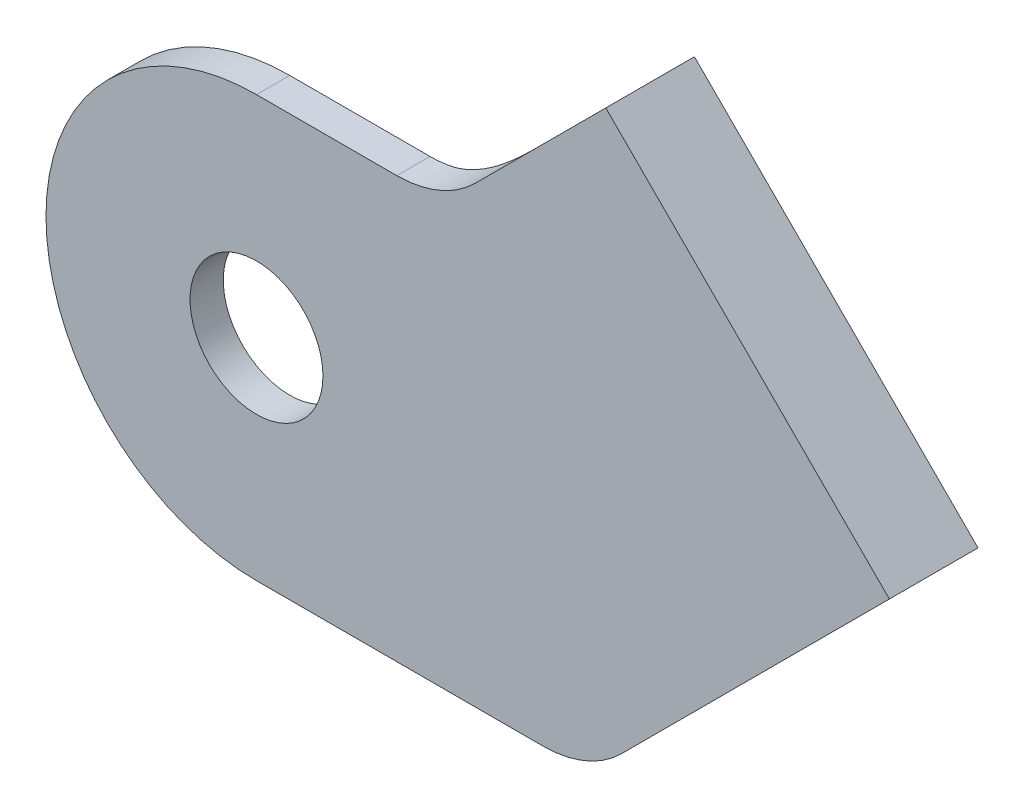
from build123d import *

# Parameters (mm, degrees)
SKETCH1_R           = 2.5
BOSS_EXTRUDE1_DEPTH = 3
SKETCH2_R           = 1.5
CUT_EXTRUDE1_DEPTH  = 77.127156728
FILLET1_R           = 10
SKETCH3_R           = 6
CUT_EXTRUDE2_DEPTH  = 77.127156728
BOSS_EXTRUDE3_DEPTH = 5
FILLET3_START       = -3.356502253
FILLET3_DEPTH       = 38.004734531
FILLET3_START_2     = -6
FILLET3_2_DEPTH     = 6


with BuildPart() as part:
    # Sketch1 → Boss-Extrude1 (new body)
    with BuildSketch(Plane.XY):
        with BuildLine():
            Line((0, -19), (30, -19))
            Line((30, -19), (64.201367261, 15.201367261))
            Line((64.201367261, 15.201367261), (58.615223689, 20.787510832))
            Line((58.615223689, 20.787510832), (44.190245353, 35.212489168))
            Line((44.190245353, 35.212489168), (38.604101782, 40.798632739))
            Line((38.604101782, 40.798632739), (16.805469042, 19))
            Line((16.805469042, 19), (0, 19))
            ThreePointArc((0, 19), (-19, 0), (0, -19))
        make_face()
        Circle(SKETCH1_R, mode=Mode.SUBTRACT)
    extrude(amount=BOSS_EXTRUDE1_DEPTH)

    # Sketch2 → Cut-Extrude1 (cut, through all)
    with BuildSketch(Plane.XY.offset(3)):
        with Locations((38.878105659, 35.574881393)):
            Circle(SKETCH2_R)
        with Locations((58.977615915, 15.475371138)):
            Circle(SKETCH2_R)
    extrude(amount=-CUT_EXTRUDE1_DEPTH, mode=Mode.SUBTRACT)

    # Fillet1
    fillet1_edges = [part.edges().sort_by_distance(p)[0] for p in [
        (16.805469042, 19, 1.5),
        (30, -19, 1.5),
    ]]
    fillet(fillet1_edges, radius=FILLET1_R)

    # Sketch3 → Cut-Extrude2 (cut, through all)
    with BuildSketch(Plane.XY.offset(3)):
        Circle(SKETCH3_R)
        Polygon((38.604101782, 40.798632739), (31.53303397, 33.727564928), (57.130299449, 8.130299449), (64.201367261, 15.201367261), align=None)
    extrude(amount=-CUT_EXTRUDE2_DEPTH, mode=Mode.SUBTRACT)

    # Sketch5 → Boss-Extrude3 (add)
    with BuildSketch(Plane(origin=(0, 0, 0), x_dir=(-1, 0, 0), z_dir=(0, 0, -1))):
        Polygon((-57.130299449, 8.130299449), (-31.53303397, 33.727564928), (-20.926432252, 23.12096321), (-46.523697731, -2.476302269), align=None)
    extrude(amount=BOSS_EXTRUDE3_DEPTH)

    # Fillet3: read off the stored shape, not the designer's step
    # Fillet3 outline → Fillet3 (add)
    with BuildSketch(Plane(origin=(0, 0, 0), x_dir=(0.707106781186548, 0.707106781186547, 0), z_dir=(0.707106781186547, -0.707106781186548, 0)).offset(FILLET3_START)):
        with BuildLine():
            ThreePointArc((23.730013537, 0), (28.202149492, -1.366750419), (31.146212025, -5))
            Line((31.146212025, -5), (31.146212025, 0))
            Line((31.146212025, 0), (23.730013537, 0))
        make_face()
    extrude(amount=FILLET3_DEPTH)

    # Fillet3 2 outline → Fillet3 2 (cut)
    with BuildSketch(Plane.XY.offset(FILLET3_START_2)):
        with BuildLine():
            Line((19.650292227, 24.397103235), (14.406247999, 19.153058913))
            ThreePointArc((14.406247999, 19.153058913), (17.283716467, 20.131400309), (19.73440123, 21.928932188))
            Line((19.73440123, 21.928932188), (20.926432252, 23.12096321))
            Line((20.926432252, 23.12096321), (19.650292227, 24.397103235))
        make_face()
    extrude(amount=FILLET3_2_DEPTH, mode=Mode.SUBTRACT)


solid = part.part
